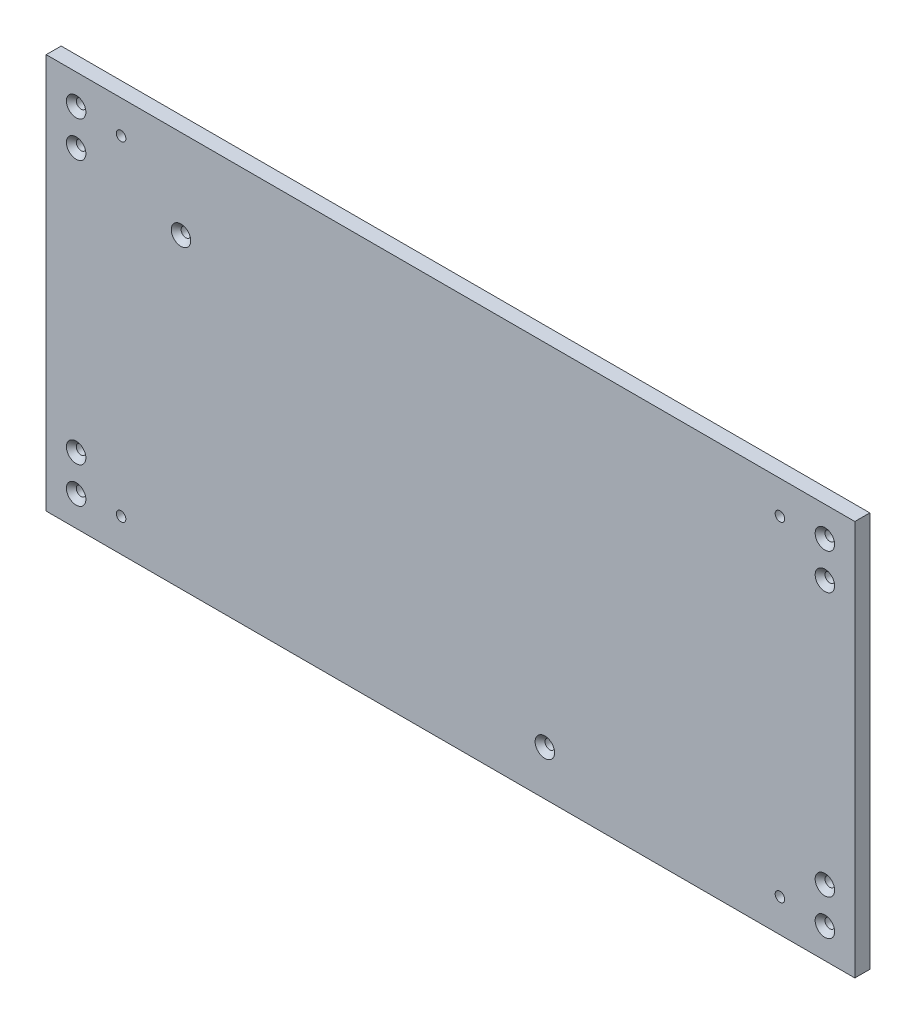
from build123d import *

# Parameters (mm, degrees)
SKETCH1_W                            = 270
SKETCH1_H                            = 132
SHEET_DEPTH                          = 2.5
F_3_2_3_2_WALLMOUNTHOLES_D           = 3.2
F_3_2_3_2_WALLMOUNTHOLES_CSINK_D     = 6.5
F_3_2_3_2_WALLMOUNTHOLES_CSINK_ANGLE = 90
F_3_2_3_2_FEETMOUNTHOLES_D           = 3.2
F_3_2_3_2_PSUHOLES_D                 = 3.2
F_3_2_3_2_PSUHOLES_CSINK_D           = 6.5
F_3_2_3_2_PSUHOLES_CSINK_ANGLE       = 90


with BuildPart() as part:
    # Sketch1 → Sheet (new, symmetric)
    with BuildSketch(Plane.XY):
        Rectangle(SKETCH1_W, SKETCH1_H)
    extrude(amount=SHEET_DEPTH, both=True)

    # Ø3.2 (3.2) WallMountHoles (through all)
    with Locations(Plane.XY.offset(2.5)):
        with Locations((-125, 56), (-125, 44), (-125, -44), (-125, -56), (125, -56), (125, -44), (125, 44), (125, 56)):
            CounterSinkHole(F_3_2_3_2_WALLMOUNTHOLES_D / 2, F_3_2_3_2_WALLMOUNTHOLES_CSINK_D / 2, counter_sink_angle=F_3_2_3_2_WALLMOUNTHOLES_CSINK_ANGLE)

    # Ø3.2 (3.2) FeetMountHoles (through all)
    with Locations(Plane.XY.offset(2.5)):
        with Locations((110, 55), (-110, 55), (-110, -55), (110, -55)):
            Hole(F_3_2_3_2_FEETMOUNTHOLES_D / 2)

    # Ø3.2 (3.2) PSUHoles (through all)
    with Locations(Plane.XY.offset(2.5)):
        with Locations((31.5, -51), (-90, 36.3)):
            CounterSinkHole(F_3_2_3_2_PSUHOLES_D / 2, F_3_2_3_2_PSUHOLES_CSINK_D / 2, counter_sink_angle=F_3_2_3_2_PSUHOLES_CSINK_ANGLE)


solid = part.part
